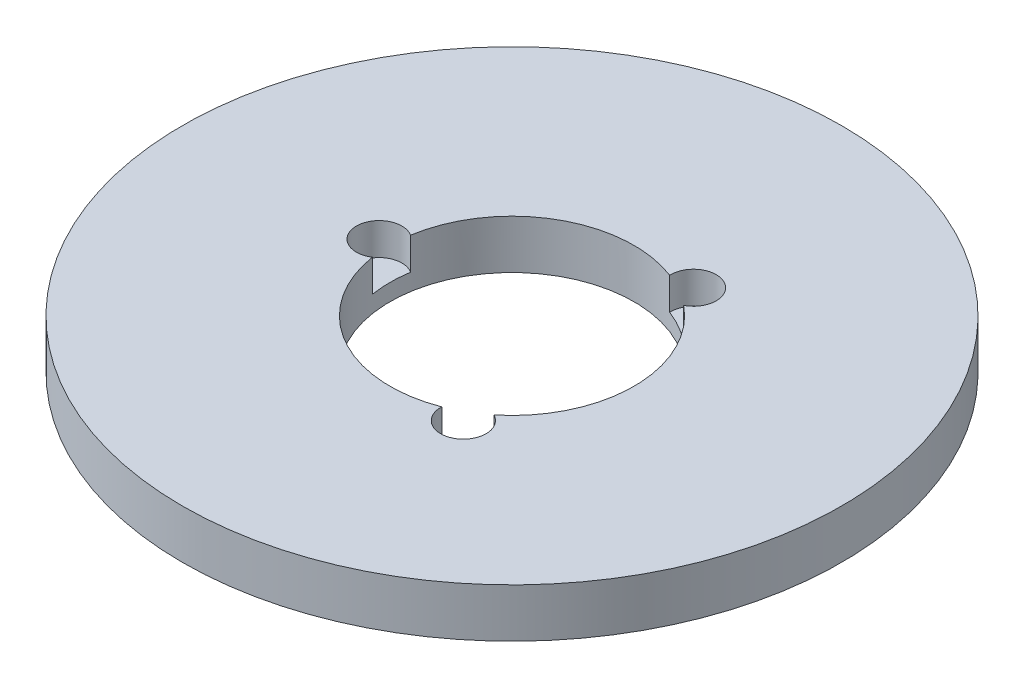
from build123d import *

# Parameters (mm, degrees)
SKETCH1_R           = 67.5
BOSS_EXTRUDE1_DEPTH = 10
SKETCH2_R           = 25
CUT_EXTRUDE1_DEPTH  = 96.981769102
SKETCH3_R           = 4.654278871
CUT_EXTRUDE2_DEPTH  = 6.565986195
CIRPATTERN1_COUNT   = 3


with BuildPart() as part:
    # Sketch1 → Boss-Extrude1 (new body)
    with BuildSketch(Plane(origin=(0, 0, 0), x_dir=(1, 0, 0), z_dir=(0, 1, 0))):
        Circle(SKETCH1_R)
    extrude(amount=BOSS_EXTRUDE1_DEPTH)

    # Sketch2 → Cut-Extrude1 (cut, through all)
    with BuildSketch(Plane(origin=(0, 0, 0), x_dir=(1, 0, 0), z_dir=(0, 1, 0))):
        Circle(SKETCH2_R)
    extrude(amount=CUT_EXTRUDE1_DEPTH, mode=Mode.SUBTRACT)

    # Sketch3 → Cut-Extrude2 (cut)
    with BuildSketch(Plane(origin=(0, 10, 0), x_dir=(1, 0, 0), z_dir=(0, 1, 0))):
        with Locations((-27.214091482, 0)):
            Circle(SKETCH3_R)
    cut_extrude2 = extrude(amount=-CUT_EXTRUDE2_DEPTH, mode=Mode.SUBTRACT)

    # CirPattern1: Cut-Extrude2 ×3 about axis
    cirpattern1_axis = Axis((0, 0, 0), (0, 1, 0))
    for i in range(1, CIRPATTERN1_COUNT):
        add(cut_extrude2.rotate(cirpattern1_axis, i * 360 / CIRPATTERN1_COUNT), mode=Mode.SUBTRACT)


solid = part.part
